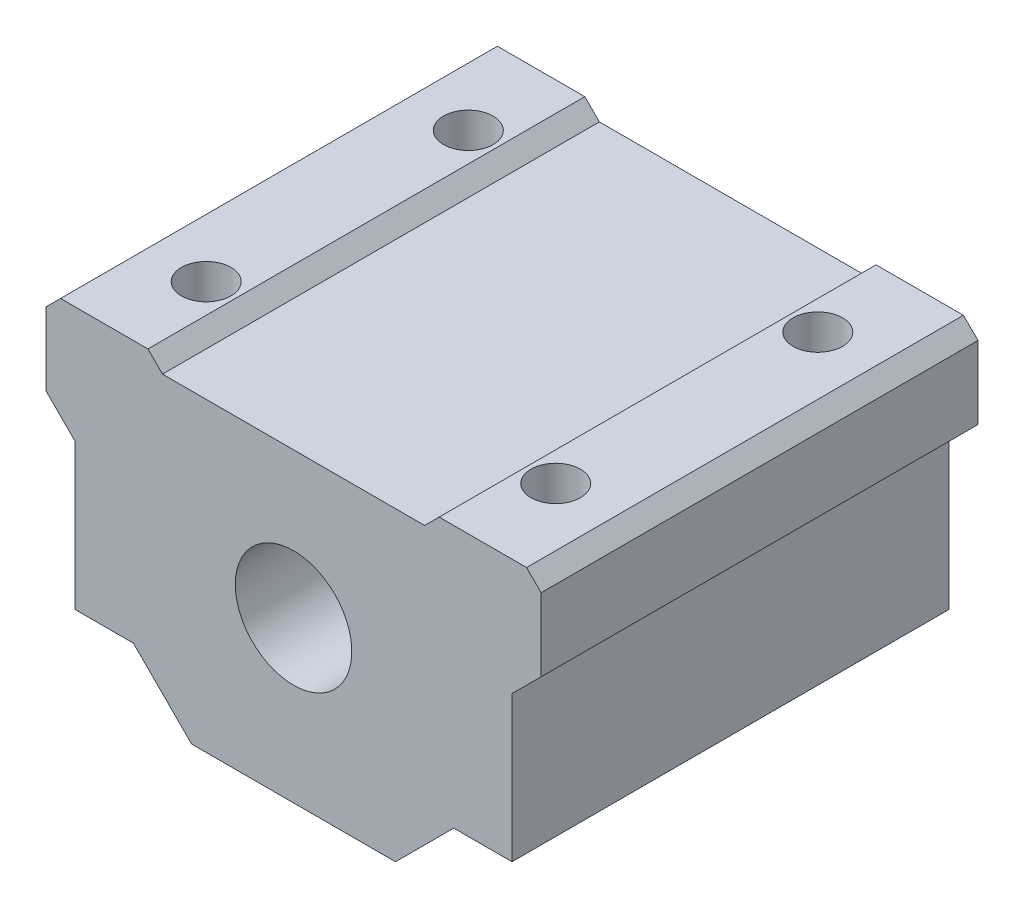
from build123d import *

# Parameters (mm, degrees)
BOSS_EXTRUDE1_OUTLINE_R = 4
BOSS_EXTRUDE1_DEPTH     = 30
CUT_EXTRUDE1_DEPTH      = 41.902322672
CUT_EXTRUDE1_DEPTH_BACK = 41.902322672
SKETCH2_R               = 1.7


# Read off the part's stored shape, not the designer's step: Boss-Extrude1
with BuildPart() as part:
    # Boss-Extrude1 outline → Boss-Extrude1 (new body)
    with BuildSketch(Plane.XY):
        Polygon((7, 0), (11, 4), (15, 4), (15, 14), (17, 16), (17, 21), (16, 22), (10, 22), (9, 21), (-9, 21), (-10, 22), (-16, 22), (-17, 21), (-17, 16), (-15, 14), (-15, 4), (-11, 4), (-7, 0), align=None)
        with Locations((0, 11)):
            Circle(BOSS_EXTRUDE1_OUTLINE_R, mode=Mode.SUBTRACT)
    extrude(amount=BOSS_EXTRUDE1_DEPTH)

    # Sketch2 → Cut-Extrude1 (cut, two sides: drawn at the far end of the back side and taken through both)
    with BuildSketch(Plane(origin=(0, 22, 0), x_dir=(1, 0, 0), z_dir=(0, 1, 0)).offset(-CUT_EXTRUDE1_DEPTH_BACK)):
        with Locations(Location((12, -6, 0), (0, 0, 233.968120928))):
            Circle(SKETCH2_R)
        with Locations(Location((-12, -6, 0), (0, 0, 53.968120928))):
            Circle(SKETCH2_R)
        with Locations(Location((12, -24, 0), (0, 0, 126.031879072))):
            Circle(SKETCH2_R)
        with Locations(Location((-12, -24, 0), (0, 0, 306.031879072))):
            Circle(SKETCH2_R)
    extrude(amount=CUT_EXTRUDE1_DEPTH + CUT_EXTRUDE1_DEPTH_BACK, mode=Mode.SUBTRACT)


solid = part.part
